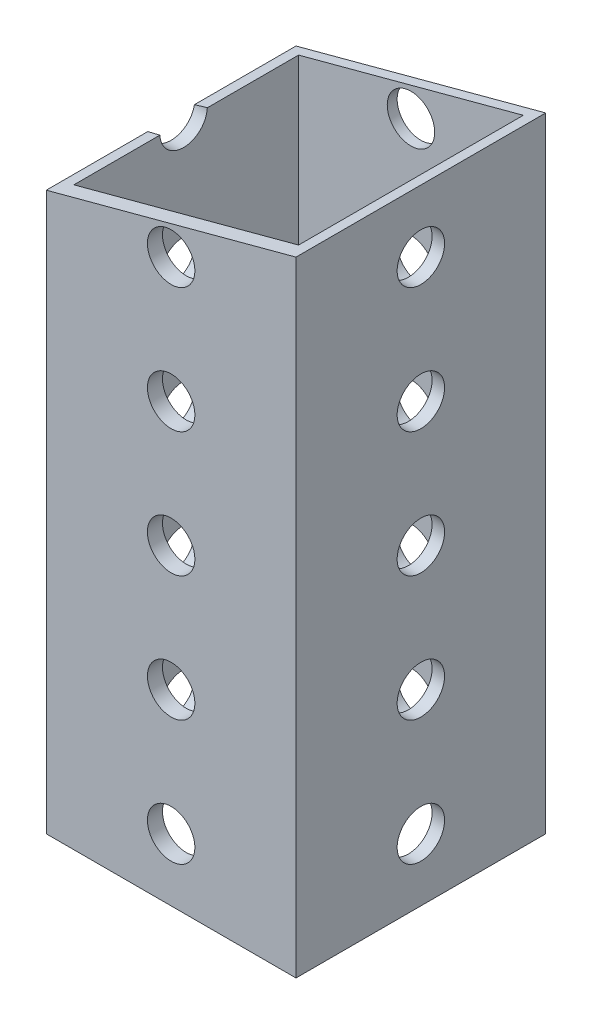
from build123d import *

# Parameters (mm, degrees)
SKETCH2_W           = 25.4
SKETCH2_H           = 25.4
SKETCH2_W_2         = 22.86
SKETCH2_H_2         = 22.86
BOSS_EXTRUDE1_DEPTH = 63.5
SKETCH3_R           = 2.413
CUT_EXTRUDE1_DEPTH  = 70.560764803
SKETCH4_R           = 2.413
CUT_EXTRUDE2_DEPTH  = 70.560764803
CUT_EXTRUDE3_DEPTH  = 70.560764803


with BuildPart() as part:
    # Sketch2 → Boss-Extrude1 (new body)
    with BuildSketch(Plane(origin=(0, 0, 0), x_dir=(1, 0, 0), z_dir=(0, 1, 0))):
        Rectangle(SKETCH2_W, SKETCH2_H)
        with Locations((0, 0.262548077)):
            Rectangle(SKETCH2_W_2, SKETCH2_H_2, mode=Mode.SUBTRACT)
    extrude(amount=BOSS_EXTRUDE1_DEPTH)

    # Sketch3 → Cut-Extrude1 (cut, through all)
    with BuildSketch(Plane(origin=(0, 0, -12.7), x_dir=(-1, 0, 0), z_dir=(0, 0, -1))):
        with Locations((0, 57.15)):
            Circle(SKETCH3_R)
        with Locations((0, 44.45)):
            Circle(SKETCH3_R)
        with Locations((0, 31.75)):
            Circle(SKETCH3_R)
        with Locations((0, 19.05)):
            Circle(SKETCH3_R)
        with Locations((0, 6.35)):
            Circle(SKETCH3_R)
        with Locations((0, -6.35)):
            Circle(SKETCH3_R)
    extrude(amount=-CUT_EXTRUDE1_DEPTH, mode=Mode.SUBTRACT)

    # Sketch4 → Cut-Extrude2 (cut, through all)
    with BuildSketch(Plane(origin=(12.7, 0, 0), x_dir=(0, 0, -1), z_dir=(1, 0, 0))):
        with Locations((0, 57.15)):
            Circle(SKETCH4_R)
        with Locations((0, 44.45)):
            Circle(SKETCH4_R)
        with Locations((0, 31.75)):
            Circle(SKETCH4_R)
        with Locations((0, 19.05)):
            Circle(SKETCH4_R)
        with Locations((0, 6.35)):
            Circle(SKETCH4_R)
        with Locations((0, -6.35)):
            Circle(SKETCH4_R)
    extrude(amount=-CUT_EXTRUDE2_DEPTH, mode=Mode.SUBTRACT)

    # Sketch5 → Cut-Extrude3 (cut, through all)
    with BuildSketch(Plane.XY.offset(12.7)):
        Polygon((12.7, 63.5), (-12.7, 56.694090512), (-12.7, 63.5), align=None)
    extrude(amount=-CUT_EXTRUDE3_DEPTH, mode=Mode.SUBTRACT)


solid = part.part
